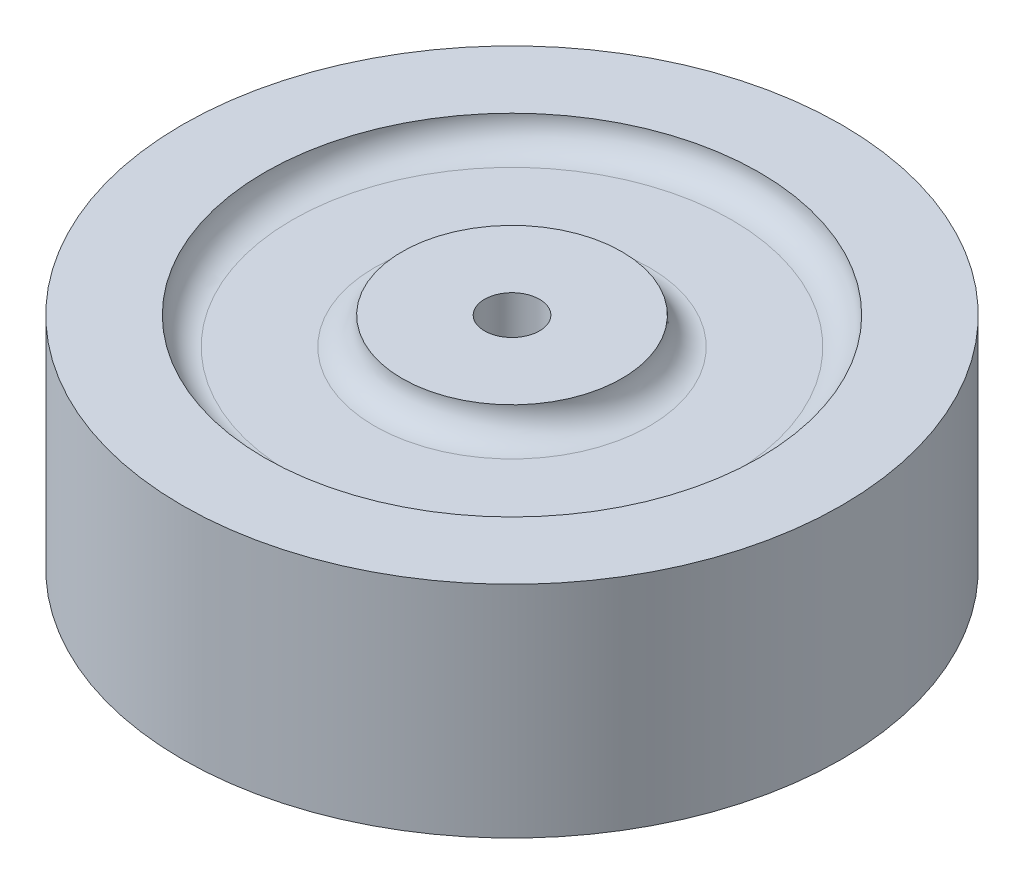
from build123d import *

# Parameters (mm, degrees)
SKETCH1_R           = 38.1
SKETCH1_R_2         = 3.175
BOSS_EXTRUDE1_DEPTH = 19.05
SKETCH2_R           = 38.1
SKETCH2_R_2         = 28.575
BOSS_EXTRUDE2_DEPTH = 3.175
BOSS_EXTRUDE3_START = 3.175
SKETCH3_R           = 38.1
SKETCH3_R_2         = 28.575
BOSS_EXTRUDE3_DEPTH = 3.175
SKETCH4_R           = 12.7
SKETCH4_R_2         = 3.175
BOSS_EXTRUDE4_DEPTH = 3.175
BOSS_EXTRUDE5_START = 3.175
SKETCH5_R           = 12.7
SKETCH5_R_2         = 3.175
BOSS_EXTRUDE5_DEPTH = 3.175
FILLET1_R           = 3.175


with BuildPart() as part:
    # Sketch1 → Boss-Extrude1 (new body)
    with BuildSketch(Plane(origin=(0, 0, 0), x_dir=(1, 0, 0), z_dir=(0, 1, 0))):
        with Locations(Location((0, 0, 0), (0, 0, 90))):
            Circle(SKETCH1_R)
        with Locations(Location((0, 0, 0), (0, 0, 90))):
            Circle(SKETCH1_R_2, mode=Mode.SUBTRACT)
    extrude(amount=BOSS_EXTRUDE1_DEPTH)

    # Sketch2 → Boss-Extrude2 (add)
    with BuildSketch(Plane(origin=(0, 19.05, 0), x_dir=(1, 0, 0), z_dir=(0, 1, 0))):
        with Locations(Location((0, 0, 0), (0, 0, 90))):
            Circle(SKETCH2_R)
        with Locations(Location((0, 0, 0), (0, 0, 270))):
            Circle(SKETCH2_R_2, mode=Mode.SUBTRACT)
    extrude(amount=BOSS_EXTRUDE2_DEPTH)

    # Sketch3 → Boss-Extrude3 (add)
    with BuildSketch(Plane.XZ.offset(BOSS_EXTRUDE3_START)):
        with Locations(Location((0, 0, 0), (0, 0, 270))):
            Circle(SKETCH3_R)
        with Locations(Location((0, 0, 0), (0, 0, 90))):
            Circle(SKETCH3_R_2, mode=Mode.SUBTRACT)
    extrude(amount=-BOSS_EXTRUDE3_DEPTH)

    # Sketch4 → Boss-Extrude4 (add)
    with BuildSketch(Plane(origin=(0, 19.05, 0), x_dir=(1, 0, 0), z_dir=(0, 1, 0))):
        with Locations(Location((0, 0, 0), (0, 0, 270))):
            Circle(SKETCH4_R)
        with Locations(Location((0, 0, 0), (0, 0, 90))):
            Circle(SKETCH4_R_2, mode=Mode.SUBTRACT)
    extrude(amount=BOSS_EXTRUDE4_DEPTH)

    # Sketch5 → Boss-Extrude5 (add)
    with BuildSketch(Plane.XZ.offset(BOSS_EXTRUDE5_START)):
        with Locations(Location((0, 0, 0), (0, 0, 90))):
            Circle(SKETCH5_R)
        with Locations(Location((0, 0, 0), (0, 0, 270))):
            Circle(SKETCH5_R_2, mode=Mode.SUBTRACT)
    extrude(amount=-BOSS_EXTRUDE5_DEPTH)

    # Fillet1
    fillet1_edges = [part.edges().sort_by_distance(p)[0] for p in [
        (0, 0, -28.575),
        (0, 19.05, -12.7),
        (0, 0, -12.7),
        (0, 19.05, -28.575),
    ]]
    fillet(fillet1_edges, radius=FILLET1_R - 0.0001)  # a hair under: the kernel refuses the full size


solid = part.part
